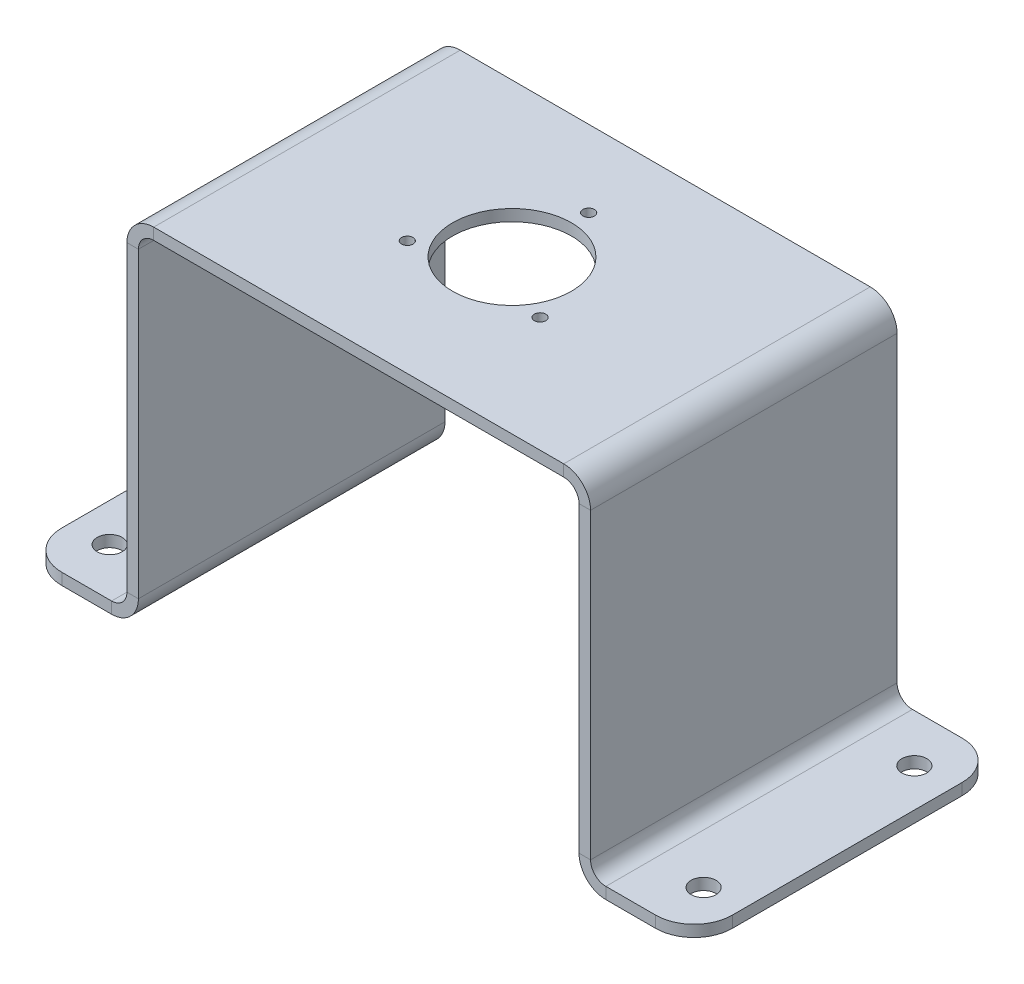
from build123d import *

# Parameters (mm, degrees)
TABAN_FLAN_1_DEPTH    = 80
IZIM2_R               = 1.5
KES_EKSTR_ZYON1_DEPTH = 10
IZIM3_R               = 15.5
KES_EKSTR_ZYON2_DEPTH = 10
RADYUS1_R             = 10
IZIM4_R               = 3.25
KES_EKSTR_ZYON3_DEPTH = 10


# Read off the part's stored shape, not the designer's step: Taban-Flanş1
with BuildPart() as part:
    # Taban-Flanş1 outline → Taban-Flanş1 (new body)
    with BuildSketch(Plane.XY):
        with BuildLine():
            Line((152, 0), (175, 0))
            Line((175, 0), (175, 3))
            Line((175, 3), (152, 3))
            ThreePointArc((152, 3), (149.171572875, 4.171572875), (148, 7))
            Line((148, 7), (148, 86))
            ThreePointArc((148, 86), (145.949747468, 90.949747468), (141, 93))
            Line((141, 93), (34, 93))
            ThreePointArc((34, 93), (29.050252532, 90.949747468), (27, 86))
            Line((27, 86), (27, 7))
            ThreePointArc((27, 7), (25.828427125, 4.171572875), (23, 3))
            Line((23, 3), (0, 3))
            Line((0, 3), (0, 0))
            Line((0, 0), (23, 0))
            ThreePointArc((23, 0), (27.949747468, 2.050252532), (30, 7))
            Line((30, 7), (30, 86))
            ThreePointArc((30, 86), (31.171572875, 88.828427125), (34, 90))
            Line((34, 90), (141, 90))
            ThreePointArc((141, 90), (143.828427125, 88.828427125), (145, 86))
            Line((145, 86), (145, 7))
            ThreePointArc((145, 7), (147.050252532, 2.050252532), (152, 0))
        make_face()
    extrude(amount=TABAN_FLAN_1_DEPTH)

    # Çizim2 → Kes-Ekstrüzyon1 (cut)
    with BuildSketch(Plane(origin=(0, 93, 0), x_dir=(1, 0, 0), z_dir=(0, 1, 0))):
        with Locations(Location((87.5, -20, 0), (0, 0, 270))):
            Circle(IZIM2_R)
        with Locations(Location((104.820508076, -50, 0), (0, 0, 270))):
            Circle(IZIM2_R)
        with Locations(Location((70.179491924, -50, 0), (0, 0, 270))):
            Circle(IZIM2_R)
    extrude(amount=-KES_EKSTR_ZYON1_DEPTH, mode=Mode.SUBTRACT)

    # Çizim3 → Kes-Ekstrüzyon2 (cut)
    with BuildSketch(Plane(origin=(0, 93, 0), x_dir=(1, 0, 0), z_dir=(0, 1, 0))):
        with Locations(Location((87.5, -40, 0), (0, 0, 270))):
            Circle(IZIM3_R)
    extrude(amount=-KES_EKSTR_ZYON2_DEPTH, mode=Mode.SUBTRACT)

    # Radyus1
    radyus1_edges = [part.edges().sort_by_distance(p)[0] for p in [
        (0, 1.5, 0),
        (175, 1.5, 0),
        (0, 1.5, 80),
        (175, 1.5, 80),
    ]]
    fillet(radyus1_edges, radius=RADYUS1_R)

    # Çizim4 → Kes-Ekstrüzyon3 (cut)
    with BuildSketch(Plane(origin=(0, 3, 0), x_dir=(1, 0, 0), z_dir=(0, 1, 0))):
        with Locations(Location((10, -12.5, 0), (0, 0, 270))):
            Circle(IZIM4_R)
        with Locations(Location((10, -67.5, 0), (0, 0, 270))):
            Circle(IZIM4_R)
        with Locations(Location((165, -67.5, 0), (0, 0, 270))):
            Circle(IZIM4_R)
        with Locations(Location((165, -12.5, 0), (0, 0, 270))):
            Circle(IZIM4_R)
    extrude(amount=-KES_EKSTR_ZYON3_DEPTH, mode=Mode.SUBTRACT)


solid = part.part
